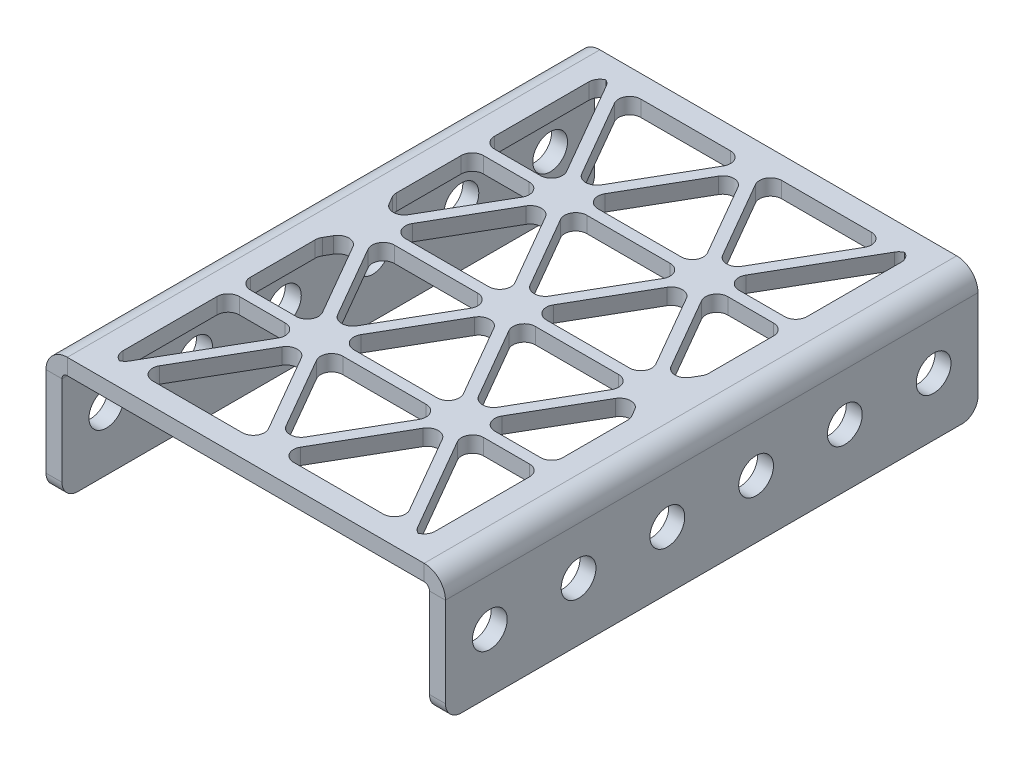
from build123d import *

# Parameters (mm, degrees)
BASE_FLANGE1_DEPTH      = 76.2
CUT_EXTRUDE1_DEPTH      = 83.021281246
CUT_EXTRUDE1_DEPTH_BACK = 83.021281246
SKETCH6_R               = 2.4892
CUT_EXTRUDE2_DEPTH      = 84.383406898
FILLET2_R               = 1.5875
FILLET3_R               = 2.286


# Sheet-metal steps are written as plain solids
with BuildPart() as part:
    # Sketch1 → Base-Flange1 (new body)
    with BuildSketch(Plane.XY):
        with BuildLine():
            Line((-26.289, -7.9375), (-26.289, 7.1755))
            ThreePointArc((-26.289, 7.1755), (-26.065815367, 7.714315367), (-25.527, 7.9375))
            Line((-25.527, 7.9375), (25.527, 7.9375))
            ThreePointArc((25.527, 7.9375), (26.065815367, 7.714315367), (26.289, 7.1755))
            Line((26.289, 7.1755), (26.289, -7.9375))
            Line((26.289, -7.9375), (28.575, -7.9375))
            Line((28.575, -7.9375), (28.575, 7.1755))
            ThreePointArc((28.575, 7.1755), (27.682261469, 9.330761469), (25.527, 10.2235))
            Line((25.527, 10.2235), (-25.527, 10.2235))
            ThreePointArc((-25.527, 10.2235), (-27.682261469, 9.330761469), (-28.575, 7.1755))
            Line((-28.575, 7.1755), (-28.575, -7.9375))
            Line((-28.575, -7.9375), (-26.289, -7.9375))
        make_face()
    extrude(amount=BASE_FLANGE1_DEPTH)

    # Sketch6 → Cut-Extrude1 (cut, two sides: drawn at the far end of the back side and taken through both)
    with BuildSketch(Plane(origin=(0, 0, 0), x_dir=(0, 0, -1), z_dir=(1, 0, 0)).offset(-CUT_EXTRUDE1_DEPTH_BACK)):
        with Locations((-31.75, 0.381)):
            Circle(SKETCH6_R)
        with Locations((-44.45, 0.381)):
            Circle(SKETCH6_R)
        with Locations((-57.15, 0.381)):
            Circle(SKETCH6_R)
        with Locations((-69.85, 0.381)):
            Circle(SKETCH6_R)
        with Locations((-19.05, 0.381)):
            Circle(SKETCH6_R)
        with Locations((-6.35, 0.381)):
            Circle(SKETCH6_R)
    extrude(amount=CUT_EXTRUDE1_DEPTH + CUT_EXTRUDE1_DEPTH_BACK, mode=Mode.SUBTRACT)

    # Sketch7 → Cut-Extrude2 (cut, through all)
    with BuildSketch(Plane(origin=(0, 10.2235, 0), x_dir=(1, 0, 0), z_dir=(0, 1, 0))):
        Polygon((-8.707163747, -21.43125), (0, -36.5125), (8.707163747, -21.43125), align=None)
        Polygon((0, -4.7625), (-8.707163747, -19.84375), (8.707163747, -19.84375), align=None)
        Polygon((-19.247414599, -3.175), (-10.081979076, -19.05), (-0.916543552, -3.175), align=None)
        Polygon((-22.352, -3.175), (-22.352, -19.84375), (-11.456794404, -19.84375), (-21.080501704, -3.175), align=None)
        Polygon((-22.352, -21.43125), (-22.352, -32.722700349), (-20.163958151, -36.5125), (-11.456794404, -21.43125), align=None)
        Polygon((-10.081979076, -22.225), (-18.789142823, -37.30625), (-1.374815329, -37.30625), align=None)
        Polygon((-18.789142823, -38.89375), (-10.081979076, -53.975), (-1.374815329, -38.89375), align=None)
        Polygon((-22.352, -43.477299651), (-22.352, -54.76875), (-11.456794404, -54.76875), (-20.163958151, -39.6875), align=None)
        Polygon((-22.352, -56.35625), (-22.352, -73.025), (-21.080501704, -73.025), (-11.456794404, -56.35625), align=None)
        Polygon((-10.081979076, -57.15), (-19.247414599, -73.025), (-0.916543552, -73.025), align=None)
        Polygon((-8.707163747, -56.35625), (0, -71.4375), (8.707163747, -56.35625), align=None)
        Polygon((0, -39.6875), (-8.707163747, -54.76875), (8.707163747, -54.76875), align=None)
        Polygon((10.081979076, -57.15), (0.916543552, -73.025), (19.247414599, -73.025), align=None)
        Polygon((1.374815329, -38.89375), (10.081979076, -53.975), (18.789142823, -38.89375), align=None)
        Polygon((10.081979076, -22.225), (1.374815329, -37.30625), (18.789142823, -37.30625), align=None)
        Polygon((11.456794404, -21.43125), (20.163958151, -36.5125), (22.352, -32.722700349), (22.352, -21.43125), align=None)
        Polygon((21.080501704, -3.175), (11.456794404, -19.84375), (22.352, -19.84375), (22.352, -3.175), align=None)
        Polygon((0.916543552, -3.175), (10.081979076, -19.05), (19.247414599, -3.175), align=None)
        Polygon((20.163958151, -39.6875), (11.456794404, -54.76875), (22.352, -54.76875), (22.352, -43.477299651), align=None)
        Polygon((11.456794404, -56.35625), (21.080501704, -73.025), (22.352, -73.025), (22.352, -56.35625), align=None)
    extrude(amount=-CUT_EXTRUDE2_DEPTH, mode=Mode.SUBTRACT)

    # Fillet2
    # the kernel refuses this fillet: 1.5875 mm, written as the material it adds along each edge
    with BuildSketch(Plane(origin=(19.247414599, 10.2235, 73.025), x_dir=(-0.5000000000000001, 0, -0.8660254037844386), z_dir=(0, -1, 0)), Plane(origin=(0.916543552, 10.2235, 73.025), x_dir=(1, 0, 0), z_dir=(0, -1, 0)), Plane(origin=(-8.707163747, 10.2235, 54.76875), x_dir=(1, 0, 0), z_dir=(0, -1, 0)), Plane(origin=(8.707163747, 10.2235, 54.76875), x_dir=(-0.5000000000000004, 0, -0.8660254037844384), z_dir=(0, -1, 0)), Plane(origin=(-0.916543552, 10.2235, 73.025), x_dir=(-0.5000000000000039, 0, -0.8660254037844364), z_dir=(0, -1, 0)), Plane(origin=(-19.247414599, 10.2235, 73.025), x_dir=(1, 0, 0), z_dir=(0, -1, 0)), Plane(origin=(0, 10.2235, 71.4375), x_dir=(0.5000000000000002, 0, -0.8660254037844385), z_dir=(0, -1, 0)), Plane(origin=(8.707163747, 10.2235, 56.35625), x_dir=(-1, 0, 0), z_dir=(0, -1, 0)), Plane(origin=(11.456794404, 10.2235, 19.84375), x_dir=(1, 0, 0), z_dir=(0, -1, 0)), Plane(origin=(20.163958151, 10.2235, 36.5125), x_dir=(0.49999999999999817, 0, -0.8660254037844397), z_dir=(0, -1, 0)), Plane(origin=(11.456794404, 10.2235, 21.43125), x_dir=(0.5000000000000061, 0, 0.866025403784435), z_dir=(0, -1, 0)), Plane(origin=(1.374815329, 10.2235, 37.30625), x_dir=(1, 0, 0), z_dir=(0, -1, 0)), Plane(origin=(18.789142823, 10.2235, 37.30625), x_dir=(-0.5000000000000026, 0, -0.8660254037844372), z_dir=(0, -1, 0)), Plane(origin=(10.081979076, 10.2235, 53.975), x_dir=(0.49999999999999684, 0, -0.8660254037844405), z_dir=(0, -1, 0)), Plane(origin=(1.374815329, 10.2235, 38.89375), x_dir=(0.5000000000000009, 0, 0.8660254037844382), z_dir=(0, -1, 0)), Plane(origin=(-11.456794404, 10.2235, 21.43125), x_dir=(-1, 0, 0), z_dir=(0, -1, 0)), Plane(origin=(-8.707163747, 10.2235, 19.84375), x_dir=(1, 0, 0), z_dir=(0, -1, 0)), Plane(origin=(8.707163747, 10.2235, 19.84375), x_dir=(-0.5000000000000023, 0, -0.8660254037844373), z_dir=(0, -1, 0)), Plane(origin=(-10.081979076, 10.2235, 19.05), x_dir=(0.4999999999999983, 0, -0.8660254037844396), z_dir=(0, -1, 0)), Plane(origin=(-19.247414599, 10.2235, 3.175), x_dir=(0.5000000000000001, 0, 0.8660254037844386), z_dir=(0, -1, 0)), Plane(origin=(-11.456794404, 10.2235, 56.35625), x_dir=(-1, 0, 0), z_dir=(0, -1, 0)), Plane(origin=(-11.456794404, 10.2235, 54.76875), x_dir=(-0.5000000000000027, 0, -0.866025403784437), z_dir=(0, -1, 0)), Plane(origin=(-10.081979076, 10.2235, 53.975), x_dir=(0.500000000000001, 0, -0.866025403784438), z_dir=(0, -1, 0)), Plane(origin=(-1.374815329, 10.2235, 38.89375), x_dir=(-1, 0, 0), z_dir=(0, -1, 0)), Plane(origin=(-18.789142823, 10.2235, 37.30625), x_dir=(1, 0, 0), z_dir=(0, -1, 0)), Plane(origin=(-1.374815329, 10.2235, 37.30625), x_dir=(-0.49999999999999895, 0, -0.8660254037844393), z_dir=(0, -1, 0)), Plane(origin=(10.081979076, 10.2235, 19.05), x_dir=(0.49999999999999856, 0, -0.8660254037844395), z_dir=(0, -1, 0)), Plane(origin=(0.916543552, 10.2235, 3.175), x_dir=(0.5000000000000044, 0, 0.8660254037844362), z_dir=(0, -1, 0)), Plane(origin=(11.456794404, 10.2235, 54.76875), x_dir=(1, 0, 0), z_dir=(0, -1, 0)), Plane(origin=(11.456794404, 10.2235, 56.35625), x_dir=(0.5000000000000004, 0, 0.8660254037844384), z_dir=(0, -1, 0)), Plane(origin=(0, 10.2235, 36.5125), x_dir=(0.4999999999999975, 0, -0.8660254037844402), z_dir=(0, -1, 0)), Plane(origin=(-8.707163747, 10.2235, 21.43125), x_dir=(0.5000000000000004, 0, 0.8660254037844384), z_dir=(0, -1, 0))) as fillet2_piece_1:
        with BuildLine():
            CenterArc((FILLET2_R * 1.73205080757, -FILLET2_R), FILLET2_R, 90, 120)
            Line((FILLET2_R * 0.866025403784, -FILLET2_R * 1.5), (0, 0))
            Line((0, 0), (FILLET2_R * 1.73205080757, 0))
        make_face()
    extrude(amount=2.286)
    with BuildSketch(Plane(origin=(10.081979076, 10.2235, 57.15), x_dir=(0.5000000000000002, 0, 0.8660254037844385), z_dir=(0, -1, 0)), Plane(origin=(0, 10.2235, 39.6875), x_dir=(0.49999999999999695, 0, 0.8660254037844405), z_dir=(0, -1, 0)), Plane(origin=(-10.081979076, 10.2235, 57.15), x_dir=(0.5000000000000038, 0, 0.8660254037844366), z_dir=(0, -1, 0)), Plane(origin=(-8.707163747, 10.2235, 56.35625), x_dir=(1, 0, 0), z_dir=(0, -1, 0)), Plane(origin=(10.081979076, 10.2235, 22.225), x_dir=(0.4999999999999991, 0, 0.8660254037844392), z_dir=(0, -1, 0)), Plane(origin=(18.789142823, 10.2235, 38.89375), x_dir=(-0.4999999999999993, 0, 0.8660254037844392), z_dir=(0, -1, 0)), Plane(origin=(-20.163958151, 10.2235, 36.5125), x_dir=(-0.5000000000000049, 0, -0.8660254037844358), z_dir=(0, -1, 0)), Plane(origin=(-11.456794404, 10.2235, 19.84375), x_dir=(-1, 0, 0), z_dir=(0, -1, 0)), Plane(origin=(0, 10.2235, 4.7625), x_dir=(0.5000000000000049, 0, 0.8660254037844357), z_dir=(0, -1, 0)), Plane(origin=(-0.916543552, 10.2235, 3.175), x_dir=(-0.49999999999999734, 0, 0.8660254037844403), z_dir=(0, -1, 0)), Plane(origin=(-20.163958151, 10.2235, 39.6875), x_dir=(0.500000000000002, 0, 0.8660254037844375), z_dir=(0, -1, 0)), Plane(origin=(-18.789142823, 10.2235, 38.89375), x_dir=(1, 0, 0), z_dir=(0, -1, 0)), Plane(origin=(-10.081979076, 10.2235, 22.225), x_dir=(0.4999999999999993, 0, 0.866025403784439), z_dir=(0, -1, 0)), Plane(origin=(19.247414599, 10.2235, 3.175), x_dir=(-0.49999999999999944, 0, 0.8660254037844389), z_dir=(0, -1, 0)), Plane(origin=(20.163958151, 10.2235, 39.6875), x_dir=(0.5000000000000102, 0, 0.8660254037844327), z_dir=(0, -1, 0)), Plane(origin=(8.707163747, 10.2235, 21.43125), x_dir=(-0.4999999999999986, 0, 0.8660254037844395), z_dir=(0, -1, 0))) as fillet2_piece_2:
        with BuildLine():
            CenterArc((FILLET2_R * 1.73205080757, FILLET2_R), FILLET2_R, 150, 120)
            Line((FILLET2_R * 0.866025403784, FILLET2_R * 1.5), (0, 0))
            Line((0, 0), (FILLET2_R * 1.73205080757, 0))
        make_face()
    extrude(amount=2.286)
    with BuildSketch(Plane(origin=(21.080501704, 10.2235, 3.175), x_dir=(1, 0, 0), z_dir=(0, -1, 0))) as fillet2_piece_3:
        with BuildLine():
            CenterArc((FILLET2_R * 0.57735026919, FILLET2_R), FILLET2_R, 210, 60)
            Line((-FILLET2_R * 0.288675134595, FILLET2_R * 0.5), (0, 0))
            Line((0, 0), (FILLET2_R * 0.57735026919, 0))
        make_face()
    extrude(amount=2.286)
    with BuildSketch(Plane(origin=(22.352, 10.2235, 3.175), x_dir=(-1, 0, 0), z_dir=(0, -1, 0)), Plane(origin=(22.352, 10.2235, 19.84375), x_dir=(0, 0, -1), z_dir=(0, -1, 0)), Plane(origin=(-22.352, 10.2235, 21.43125), x_dir=(0, 0, 1), z_dir=(0, -1, 0)), Plane(origin=(-22.352, 10.2235, 19.84375), x_dir=(1, 0, 0), z_dir=(0, -1, 0)), Plane(origin=(-22.352, 10.2235, 3.175), x_dir=(0, 0, 1), z_dir=(0, -1, 0)), Plane(origin=(-22.352, 10.2235, 73.025), x_dir=(1, 0, 0), z_dir=(0, -1, 0)), Plane(origin=(-22.352, 10.2235, 54.76875), x_dir=(1, 0, 0), z_dir=(0, -1, 0)), Plane(origin=(22.352, 10.2235, 54.76875), x_dir=(0, 0, -1), z_dir=(0, -1, 0)), Plane(origin=(22.352, 10.2235, 73.025), x_dir=(0, 0, -1), z_dir=(0, -1, 0))) as fillet2_piece_4:
        with BuildLine():
            CenterArc((FILLET2_R, -FILLET2_R), FILLET2_R, 90, 90)
            Line((0, -FILLET2_R), (0, 0))
            Line((0, 0), (FILLET2_R, 0))
        make_face()
    extrude(amount=2.286)
    with BuildSketch(Plane(origin=(22.352, 10.2235, 21.43125), x_dir=(0, 0, 1), z_dir=(0, -1, 0)), Plane(origin=(-22.352, 10.2235, 56.35625), x_dir=(1, 0, 0), z_dir=(0, -1, 0)), Plane(origin=(22.352, 10.2235, 56.35625), x_dir=(0, 0, 1), z_dir=(0, -1, 0))) as fillet2_piece_5:
        with BuildLine():
            CenterArc((FILLET2_R, FILLET2_R), FILLET2_R, 180, 90)
            Line((0, FILLET2_R), (0, 0))
            Line((0, 0), (FILLET2_R, 0))
        make_face()
    extrude(amount=2.286)
    with BuildSketch(Plane(origin=(22.352, 10.2235, 32.722700349), x_dir=(0, 0, -1), z_dir=(0, -1, 0)), Plane(origin=(-22.352, 10.2235, 32.722700349), x_dir=(0.499999999999997, 0, 0.8660254037844404), z_dir=(0, -1, 0)), Plane(origin=(-22.352, 10.2235, 43.477299651), x_dir=(0, 0, 1), z_dir=(0, -1, 0)), Plane(origin=(22.352, 10.2235, 43.477299651), x_dir=(-0.49999999999999073, 0, -0.866025403784444), z_dir=(0, -1, 0))) as fillet2_piece_6:
        with BuildLine():
            CenterArc((FILLET2_R * 0.267949192431, -FILLET2_R), FILLET2_R, 90, 30)
            Line((-FILLET2_R * 0.232050807569, -FILLET2_R * 0.133974596216), (0, 0))
            Line((0, 0), (FILLET2_R * 0.267949192431, 0))
        make_face()
    extrude(amount=2.286)
    with BuildSketch(Plane(origin=(-21.080501704, 10.2235, 3.175), x_dir=(-1, 0, 0), z_dir=(0, -1, 0)), Plane(origin=(-21.080501704, 10.2235, 73.025), x_dir=(0.4999999999999988, 0, -0.8660254037844394), z_dir=(0, -1, 0)), Plane(origin=(21.080501704, 10.2235, 73.025), x_dir=(1, 0, 0), z_dir=(0, -1, 0))) as fillet2_piece_7:
        with BuildLine():
            CenterArc((FILLET2_R * 0.57735026919, -FILLET2_R), FILLET2_R, 90, 60)
            Line((-FILLET2_R * 0.288675134595, -FILLET2_R * 0.5), (0, 0))
            Line((0, 0), (FILLET2_R * 0.57735026919, 0))
        make_face()
    extrude(amount=2.286)

    # Fillet3
    fillet3_edges = [part.edges().sort_by_distance(p)[0] for p in [
        (27.432, -7.9375, 0),
        (-27.432, -7.9375, 0),
        (27.432, -7.9375, 76.2),
        (-27.432, -7.9375, 76.2),
    ]]
    fillet(fillet3_edges, radius=FILLET3_R)


solid = part.part
